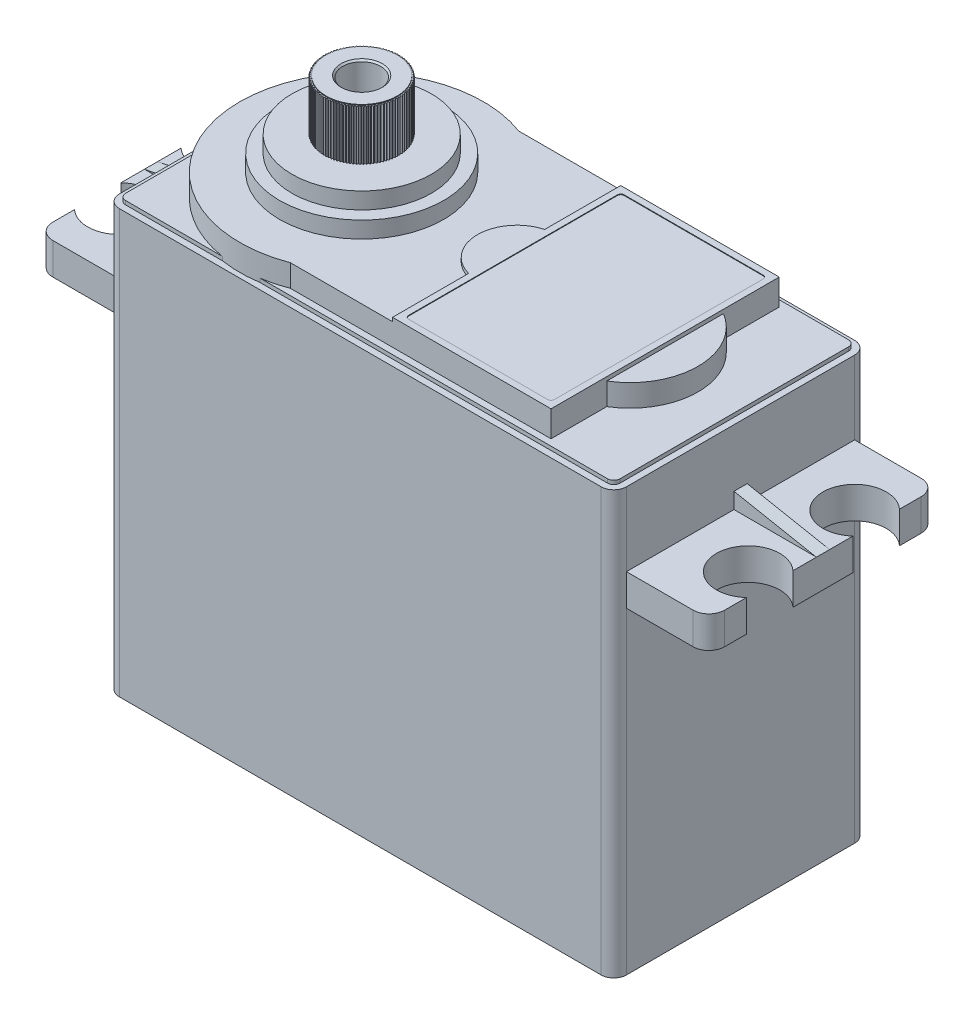
from build123d import *

# Parameters (mm, degrees)
SKETCH2_W                 = 40
SKETCH2_H                 = 20
BOSS_EXTRUDE1_DEPTH       = 33.35
SKETCH3_W                 = 39
SKETCH3_H                 = 19
BOSS_EXTRUDE2_DEPTH       = 0.3
FILLET5_R                 = 1
FILLET6_R                 = 0.5
SKETCH4_W                 = 18
SKETCH4_H                 = 2.5
BOSS_EXTRUDE3_DEPTH       = 6.5
FILLET7_R                 = 1.25
SKETCH5_R                 = 2.5
CUT_EXTRUDE1_DEPTH        = 3
BOSS_EXTRUDE4_DEPTH       = 0.52
FILLET7_OF_MIRROR3_R      = 1.25
BOSS_EXTRUDE5_DEPTH       = 1.2
CHAMFER1_SIZE             = 1.2
CUT_EXTRUDE2_START        = -1.2
CUT_EXTRUDE2_DEPTH        = 1.2
SKETCH11_R                = 1
CUT_EXTRUDE3_DEPTH        = 3.5
SKETCH12_R                = 2
CUT_EXTRUDE4_DEPTH        = 1.3
CHAMFER2_SIZE             = 0.25
SKETCH13_R                = 2.5
CUT_EXTRUDE5_DEPTH        = 8.75
SKETCH14_W                = 6.85
SKETCH14_H                = 3.5
BOSS_EXTRUDE6_DEPTH       = 5.4
SKETCH15_R                = 0.6
BOSS_EXTRUDE8_DEPTH       = 1
SKETCH16_R                = 0.6
BOSS_EXTRUDE9_DEPTH       = 1
SKETCH17_R                = 0.6
BOSS_EXTRUDE10_DEPTH      = 1
BOSS_EXTRUDE11_DEPTH      = 1.75
BOSS_EXTRUDE11_DEPTH_BACK = 0.5
SKETCH19_W                = 20.55
SKETCH19_H                = 18
BOSS_EXTRUDE12_DEPTH      = 1.75
BOSS_EXTRUDE13_DEPTH      = 1.75
BOSS_EXTRUDE14_DEPTH      = 0.3
SKETCH22_R                = 6.475
BOSS_EXTRUDE15_DEPTH      = 1.3
SKETCH23_R                = 5.5
BOSS_EXTRUDE16_DEPTH      = 1.3
SKETCH25_R                = 2.95
BOSS_EXTRUDE17_DEPTH      = 4
SKETCH26_R                = 1.5
CUT_EXTRUDE7_DEPTH        = 5
CUT_EXTRUDE10_START       = -4
CUT_EXTRUDE10_DEPTH       = 4
CIRPATTERN1_START         = 38
CIRPATTERN1_DEPTH         = 4
CUT_EXTRUDE11_DEPTH       = 4
CIRPATTERN2_START         = 38
CIRPATTERN2_DEPTH         = 4
CHAMFER3_SIZE             = 0.125
SKETCH30_OUTSIDE_W        = 69.248
SKETCH30_OUTSIDE_H        = 36.248
SKETCH30_OUTSIDE_R        = 2.8
CUT_EXTRUDE12_DEPTH       = 0.0625
CUT_EXTRUDE13_START       = -5
SKETCH31_W                = 6.25
SKETCH31_H                = 2.9
SKETCH31_R                = 0.6
CUT_EXTRUDE13_DEPTH       = 5
CUT_EXTRUDE14_DEPTH       = 0.05


# Read off the part's stored shape, not the designer's step: CirPattern1, CirPattern2
with BuildPart() as part:
    # Sketch2 → Boss-Extrude1 (new body)
    with BuildSketch(Plane(origin=(0, 0, 0), x_dir=(1, 0, 0), z_dir=(0, 1, 0))):
        Rectangle(SKETCH2_W, SKETCH2_H)
    extrude(amount=BOSS_EXTRUDE1_DEPTH)

    # Sketch3 → Boss-Extrude2 (add)
    with BuildSketch(Plane(origin=(0, 33.35, 0), x_dir=(1, 0, 0), z_dir=(0, 1, 0))):
        Rectangle(SKETCH3_W, SKETCH3_H)
    extrude(amount=BOSS_EXTRUDE2_DEPTH)

    # Fillet5
    fillet5_edges = [part.edges().sort_by_distance(p)[0] for p in [
        (-20, 16.675, -10),
        (20, 16.675, -10),
        (20, 16.675, 10),
        (-20, 16.675, 10),
    ]]
    fillet(fillet5_edges, radius=FILLET5_R)

    # Fillet6
    fillet6_edges = [part.edges().sort_by_distance(p)[0] for p in [
        (-19.5, 33.5, -9.5),
        (-19.5, 33.5, 9.5),
        (19.5, 33.5, 9.5),
        (19.5, 33.5, -9.5),
    ]]
    fillet(fillet6_edges, radius=FILLET6_R)

    # Sketch4 → Boss-Extrude3 (add)
    with BuildSketch(Plane.ZY.offset(20)):
        with Locations((0, 26.3)):
            Rectangle(SKETCH4_W, SKETCH4_H)
    boss_extrude3 = extrude(amount=BOSS_EXTRUDE3_DEPTH)

    # Fillet7
    fillet7_edges = [part.edges().sort_by_distance(p)[0] for p in [
        (-26.5, 26.3, 9),
        (-26.5, 26.3, -9),
    ]]
    fillet(fillet7_edges, radius=FILLET7_R)

    # Sketch5 → Cut-Extrude1 (cut)
    with BuildSketch(Plane(origin=(0, 27.55, 0), x_dir=(1, 0, 0), z_dir=(0, 1, 0))):
        with Locations((-24.8, 4.2)):
            Circle(SKETCH5_R)
        with Locations((-24.8, -4.2)):
            Circle(SKETCH5_R)
    cut_extrude1 = extrude(amount=-CUT_EXTRUDE1_DEPTH, mode=Mode.SUBTRACT)

    # Sketch7 → Boss-Extrude4 (add, symmetric)
    with BuildSketch(Plane(origin=(0, 0, 0), x_dir=(-1, 0, 0), z_dir=(0, 0, -1))):
        Polygon((26.5, 27.55), (20, 28.8), (20, 27.55), align=None)
    boss_extrude4 = extrude(amount=BOSS_EXTRUDE4_DEPTH, both=True)

    # Mirror3: Boss-Extrude3, Cut-Extrude1, Boss-Extrude4 across plane
    add(boss_extrude3.mirror(Plane.ZY))
    add(cut_extrude1.mirror(Plane.ZY), mode=Mode.SUBTRACT)
    add(boss_extrude4.mirror(Plane.ZY))

    # Fillet7 of Mirror3
    fillet7_of_mirror3_edges = [part.edges().sort_by_distance(p)[0] for p in [
        (26.5, 26.3, 9),
        (26.5, 26.3, -9),
    ]]
    fillet(fillet7_of_mirror3_edges, radius=FILLET7_OF_MIRROR3_R)

    # Sketch9 → Boss-Extrude5 (add)
    with BuildSketch(Plane.XZ):
        with BuildLine():
            Line((-19, 10), (19, 10))
            ThreePointArc((19, 10), (19.707106781, 9.707106781), (20, 9))
            Line((20, 9), (20, -9))
            ThreePointArc((20, -9), (19.707106781, -9.707106781), (19, -10))
            Line((19, -10), (-19, -10))
            ThreePointArc((-19, -10), (-19.707106781, -9.707106781), (-20, -9))
            Line((-20, -9), (-20, 9))
            ThreePointArc((-20, 9), (-19.707106781, 9.707106781), (-19, 10))
        make_face()
    extrude(amount=BOSS_EXTRUDE5_DEPTH)

    # Chamfer1
    # the kernel refuses this chamfer: 1.2 mm, written as the material it takes off along each edge
    with BuildSketch(Plane(origin=(-20, -1.2, -12.086019586), x_dir=(-0.027495876610587354, 0.9996219169112968, 0), z_dir=(0, 0, 1))) as chamfer1_piece_1:
        Polygon((CHAMFER1_SIZE * 0.999621916911, -CHAMFER1_SIZE * 0.0274958766106), (-CHAMFER1_SIZE * 0.0274958766106, -CHAMFER1_SIZE * 0.999621916911), (0, 0), align=None)
    extrude(amount=24.172039171, mode=Mode.SUBTRACT)
    with BuildSketch(Plane(origin=(22.086019586, -1.2, -10), x_dir=(0, 0.9996219169112968, -0.027495876610585914), z_dir=(-1, 0, 0)), Plane(origin=(-22.086019586, -1.2, 10), x_dir=(0, 0.9996219169112968, 0.027495876610585914), z_dir=(1, 0, 0))) as chamfer1_piece_2:
        Polygon((CHAMFER1_SIZE * 0.999621916911, -CHAMFER1_SIZE * 0.0274958766106), (-CHAMFER1_SIZE * 0.0274958766106, -CHAMFER1_SIZE * 0.999621916911), (0, 0), align=None)
    extrude(amount=44.172039171, mode=Mode.SUBTRACT)
    with BuildSketch(Plane(origin=(20, -1.2, 12.086019586), x_dir=(-0.9996219169112968, -0.027495876610586445, 0), z_dir=(0, 0, -1))) as chamfer1_piece_3:
        Polygon((CHAMFER1_SIZE * 0.999621916911, CHAMFER1_SIZE * 0.0274958766106), (-CHAMFER1_SIZE * 0.0274958766106, CHAMFER1_SIZE * 0.999621916911), (0, 0), align=None)
    extrude(amount=24.172039171, mode=Mode.SUBTRACT)

    # Sketch10 → Cut-Extrude2 (cut)
    with BuildSketch(Plane.XZ.offset(1.2).offset(CUT_EXTRUDE2_START)):
        with BuildLine():
            Line((-15.2, 10), (-15.2, 7.6))
            ThreePointArc((-15.2, 7.6), (-15.902943725, 5.902943725), (-17.6, 5.2))
            Line((-17.6, 5.2), (-20, 5.2))
            Line((-20, 5.2), (-20, 9))
            ThreePointArc((-20, 9), (-19.707106781, 9.707106781), (-19, 10))
            Line((-19, 10), (-15.2, 10))
        make_face()
        with BuildLine():
            Line((20, 9), (20, 5.2))
            Line((20, 5.2), (17.6, 5.2))
            ThreePointArc((17.6, 5.2), (15.902943725, 5.902943725), (15.2, 7.6))
            Line((15.2, 7.6), (15.2, 10))
            Line((15.2, 10), (19, 10))
            ThreePointArc((19, 10), (19.707106781, 9.707106781), (20, 9))
        make_face()
        with BuildLine():
            Line((15.2, -10), (15.2, -7.6))
            ThreePointArc((15.2, -7.6), (15.902943725, -5.902943725), (17.6, -5.2))
            Line((17.6, -5.2), (20, -5.2))
            Line((20, -5.2), (20, -9))
            ThreePointArc((20, -9), (19.707106781, -9.707106781), (19, -10))
            Line((19, -10), (15.2, -10))
        make_face()
        with BuildLine():
            Line((-20, -9), (-20, -5.2))
            Line((-20, -5.2), (-17.6, -5.2))
            ThreePointArc((-17.6, -5.2), (-15.902943725, -5.902943725), (-15.2, -7.6))
            Line((-15.2, -7.6), (-15.2, -10))
            Line((-15.2, -10), (-19, -10))
            ThreePointArc((-19, -10), (-19.707106781, -9.707106781), (-20, -9))
        make_face()
    extrude(amount=CUT_EXTRUDE2_DEPTH, mode=Mode.SUBTRACT)

    # Sketch11 → Cut-Extrude3 (cut)
    with BuildSketch(Plane.XZ):
        with Locations(Location((-17.6, 7.6, 0), (0, 0, 270))):
            Circle(SKETCH11_R)
        with Locations(Location((17.6, 7.6, 0), (0, 0, 90))):
            Circle(SKETCH11_R)
        with Locations(Location((17.6, -7.6, 0), (0, 0, 270))):
            Circle(SKETCH11_R)
        with Locations(Location((-17.6, -7.6, 0), (0, 0, 90))):
            Circle(SKETCH11_R)
    extrude(amount=-CUT_EXTRUDE3_DEPTH, mode=Mode.SUBTRACT)

    # Sketch12 → Cut-Extrude4 (cut)
    with BuildSketch(Plane.XZ):
        with Locations(Location((-17.6, 7.6, 0), (0, 0, 270))):
            Circle(SKETCH12_R)
        with Locations(Location((17.6, 7.6, 0), (0, 0, 90))):
            Circle(SKETCH12_R)
        with Locations(Location((17.6, -7.6, 0), (0, 0, 270))):
            Circle(SKETCH12_R)
        with Locations(Location((-17.6, -7.6, 0), (0, 0, 90))):
            Circle(SKETCH12_R)
    extrude(amount=-CUT_EXTRUDE4_DEPTH, mode=Mode.SUBTRACT)

    # Chamfer2
    chamfer2_edges = [part.edges().sort_by_distance(p)[0] for p in [
        (-17.6, 0, -9.6),
        (17.6, 0, -5.6),
        (17.6, 0, 5.6),
        (-17.6, 0, 9.6),
    ]]
    chamfer(chamfer2_edges, length=CHAMFER2_SIZE)

    # Sketch13 → Cut-Extrude5 (cut)
    with BuildSketch(Plane.ZY.offset(20)):
        with Locations((0, 16.85)):
            Circle(SKETCH13_R)
    extrude(amount=-CUT_EXTRUDE5_DEPTH, mode=Mode.SUBTRACT)

    # Sketch14 → Boss-Extrude6 (add)
    with BuildSketch(Plane.ZY.offset(20)):
        with Locations((0, 6.25)):
            Rectangle(SKETCH14_W, SKETCH14_H)
    extrude(amount=BOSS_EXTRUDE6_DEPTH)

    # Sketch15 → Boss-Extrude8 (add)
    with BuildSketch(Plane.ZY.offset(25.4)):
        with Locations((-1.225, 6.25)):
            Circle(SKETCH15_R)
    extrude(amount=BOSS_EXTRUDE8_DEPTH)

    # Sketch16 → Boss-Extrude9 (add)
    with BuildSketch(Plane.ZY.offset(25.4)):
        with Locations((0, 6.25)):
            Circle(SKETCH16_R)
    extrude(amount=BOSS_EXTRUDE9_DEPTH)

    # Sketch17 → Boss-Extrude10 (add)
    with BuildSketch(Plane.ZY.offset(25.4)):
        with Locations((1.23, 6.25)):
            Circle(SKETCH17_R)
    extrude(amount=BOSS_EXTRUDE10_DEPTH)

    # Sketch18 → Boss-Extrude11 (add, two sides: drawn at the far end of the back side and taken through both)
    with BuildSketch(Plane(origin=(0, 33.65, 0), x_dir=(1, 0, 0), z_dir=(0, 1, 0)).offset(-BOSS_EXTRUDE11_DEPTH_BACK)):
        with BuildLine():
            Line((-6.5, 9), (-6.5, -9))
            ThreePointArc((-6.5, -9), (-19.5, 0), (-6.5, 9))
        make_face()
    extrude(amount=BOSS_EXTRUDE11_DEPTH + BOSS_EXTRUDE11_DEPTH_BACK)

    # Sketch19 → Boss-Extrude12 (add)
    with BuildSketch(Plane(origin=(0, 33.65, 0), x_dir=(1, 0, 0), z_dir=(0, 1, 0))):
        with Locations((3.775, 0)):
            Rectangle(SKETCH19_W, SKETCH19_H)
    extrude(amount=BOSS_EXTRUDE12_DEPTH)

    # Sketch20 → Boss-Extrude13 (add)
    with BuildSketch(Plane(origin=(0, 33.65, 0), x_dir=(1, 0, 0), z_dir=(0, 1, 0))):
        with BuildLine():
            Line((14.05, 4.6), (14.05, -4.6))
            ThreePointArc((14.05, -4.6), (16.65, 0), (14.05, 4.6))
        make_face()
    extrude(amount=BOSS_EXTRUDE13_DEPTH)

    # Sketch21 → Boss-Extrude14 (add)
    with BuildSketch(Plane(origin=(0, 35.4, 0), x_dir=(1, 0, 0), z_dir=(0, 1, 0))):
        with BuildLine():
            Line((14.05, 9), (1.55, 9))
            Line((1.55, 9), (1.55, 3))
            ThreePointArc((1.55, 3), (-0.75, 0), (1.55, -3))
            Line((1.55, -3), (1.55, -9))
            Line((1.55, -9), (14.05, -9))
            Line((14.05, -9), (14.05, 9))
        make_face()
    extrude(amount=BOSS_EXTRUDE14_DEPTH)

    # Sketch22 → Boss-Extrude15 (add)
    with BuildSketch(Plane(origin=(0, 35.4, 0), x_dir=(1, 0, 0), z_dir=(0, 1, 0))):
        with Locations(Location((-9.884615385, 0, 0), (0, 0, 270))):
            Circle(SKETCH22_R)
    extrude(amount=BOSS_EXTRUDE15_DEPTH)

    # Sketch23 → Boss-Extrude16 (add)
    with BuildSketch(Plane(origin=(0, 36.7, 0), x_dir=(1, 0, 0), z_dir=(0, 1, 0))):
        with Locations(Location((-9.884615385, 0, 0), (0, 0, 270))):
            Circle(SKETCH23_R)
    extrude(amount=BOSS_EXTRUDE16_DEPTH)

    # Sketch25 → Boss-Extrude17 (add)
    with BuildSketch(Plane(origin=(0, 38, 0), x_dir=(1, 0, 0), z_dir=(0, 1, 0))):
        with Locations(Location((-9.884615385, 0, 0), (0, 0, 270))):
            Circle(SKETCH25_R)
    extrude(amount=BOSS_EXTRUDE17_DEPTH)

    # Sketch26 → Cut-Extrude7 (cut)
    with BuildSketch(Plane(origin=(0, 42, 0), x_dir=(1, 0, 0), z_dir=(0, 1, 0))):
        with Locations(Location((-9.884615385, 0, 0), (0, 0, 270))):
            Circle(SKETCH26_R)
    extrude(amount=-CUT_EXTRUDE7_DEPTH, mode=Mode.SUBTRACT)

    # Sketch28 → Cut-Extrude10 (cut)
    with BuildSketch(Plane(origin=(0, 42, 0), x_dir=(1, 0, 0), z_dir=(0, 1, 0)).offset(CUT_EXTRUDE10_START)):
        with BuildLine():
            Line((-9.884615385, 2.850000942), (-9.786256523, 2.948359804))
            ThreePointArc((-9.786256523, 2.948359804), (-9.884615385, 2.95), (-9.982974246, 2.948359804))
            Line((-9.982974246, 2.948359804), (-9.884615385, 2.850000942))
        make_face()
    extrude(amount=CUT_EXTRUDE10_DEPTH, mode=Mode.SUBTRACT)

    # CirPattern1 outline → CirPattern1 (cut)
    with BuildSketch(Plane(origin=(0, 0, 0), x_dir=(1, 0, 0), z_dir=(0, 1, 0)).offset(CIRPATTERN1_START)):
        with BuildLine():
            Line((-6.938157395, 0.096457047), (-7.034614442, 0))
            Line((-7.034614442, 0), (-6.938157395, -0.096457047))
            Line((-6.938157395, -0.096457047), (-7.040716513, -0.18639898))
            Line((-7.040716513, -0.18639898), (-6.95077458, -0.288958098))
            Line((-6.95077458, -0.288958098), (-7.058996595, -0.371999771))
            Line((-7.058996595, -0.371999771), (-6.975954923, -0.480221786))
            Line((-6.975954923, -0.480221786), (-7.089376411, -0.556007602))
            Line((-7.089376411, -0.556007602), (-7.013590595, -0.66942909))
            Line((-7.013590595, -0.66942909), (-7.131725869, -0.737634522))
            Line((-7.131725869, -0.737634522), (-7.063520437, -0.855769796))
            Line((-7.063520437, -0.855769796), (-7.185863623, -0.916102779))
            Line((-7.185863623, -0.916102779), (-7.125530641, -1.038445965))
            Line((-7.125530641, -1.038445965), (-7.251557846, -1.090648143))
            Line((-7.251557846, -1.090648143), (-7.199355668, -1.216675349))
            Line((-7.199355668, -1.216675349), (-7.328527226, -1.260523184))
            Line((-7.328527226, -1.260523184), (-7.284679391, -1.389694742))
            Line((-7.284679391, -1.389694742), (-7.416442168, -1.425000471))
            Line((-7.416442168, -1.425000471), (-7.381136438, -1.556763248))
            Line((-7.381136438, -1.556763248), (-7.514926206, -1.583375688))
            Line((-7.514926206, -1.583375688), (-7.488313766, -1.717165456))
            Line((-7.488313766, -1.717165456), (-7.623557617, -1.734970646))
            Line((-7.623557617, -1.734970646), (-7.605752426, -1.870214497))
            Line((-7.605752426, -1.870214497), (-7.741871225, -1.879136194))
            Line((-7.741871225, -1.879136194), (-7.732949527, -2.015254993))
            Line((-7.732949527, -2.015254993), (-7.869360392, -2.015254993))
            Line((-7.869360392, -2.015254993), (-7.869360392, -2.151665857))
            Line((-7.869360392, -2.151665857), (-8.00547919, -2.14274416))
            Line((-8.00547919, -2.14274416), (-8.014400888, -2.278862958))
            Line((-8.014400888, -2.278862958), (-8.149644738, -2.261057767))
            Line((-8.149644738, -2.261057767), (-8.167449929, -2.396301618))
            Line((-8.167449929, -2.396301618), (-8.301239697, -2.369689179))
            Line((-8.301239697, -2.369689179), (-8.327852136, -2.503478947))
            Line((-8.327852136, -2.503478947), (-8.459614913, -2.468173217))
            Line((-8.459614913, -2.468173217), (-8.494920643, -2.599935994))
            Line((-8.494920643, -2.599935994), (-8.624092201, -2.556088159))
            Line((-8.624092201, -2.556088159), (-8.667940036, -2.685259716))
            Line((-8.667940036, -2.685259716), (-8.793967242, -2.633057538))
            Line((-8.793967242, -2.633057538), (-8.84616942, -2.759084744))
            Line((-8.84616942, -2.759084744), (-8.968512606, -2.698751761))
            Line((-8.968512606, -2.698751761), (-9.028845588, -2.821094947))
            Line((-9.028845588, -2.821094947), (-9.146980862, -2.752889515))
            Line((-9.146980862, -2.752889515), (-9.215186294, -2.871024789))
            Line((-9.215186294, -2.871024789), (-9.328607783, -2.795238973))
            Line((-9.328607783, -2.795238973), (-9.404393599, -2.908660462))
            Line((-9.404393599, -2.908660462), (-9.512615614, -2.825618789))
            Line((-9.512615614, -2.825618789), (-9.595657287, -2.933840804))
            Line((-9.595657287, -2.933840804), (-9.698216405, -2.843898872))
            Line((-9.698216405, -2.843898872), (-9.788158337, -2.94645799))
            Line((-9.788158337, -2.94645799), (-9.884615385, -2.850000942))
            Line((-9.884615385, -2.850000942), (-9.981072432, -2.94645799))
            Line((-9.981072432, -2.94645799), (-10.071014365, -2.843898872))
            Line((-10.071014365, -2.843898872), (-10.173573483, -2.933840804))
            Line((-10.173573483, -2.933840804), (-10.256615155, -2.825618789))
            Line((-10.256615155, -2.825618789), (-10.36483717, -2.908660462))
            Line((-10.36483717, -2.908660462), (-10.440622986, -2.795238973))
            Line((-10.440622986, -2.795238973), (-10.554044475, -2.871024789))
            Line((-10.554044475, -2.871024789), (-10.622249907, -2.752889515))
            Line((-10.622249907, -2.752889515), (-10.740385181, -2.821094947))
            Line((-10.740385181, -2.821094947), (-10.800718164, -2.698751761))
            Line((-10.800718164, -2.698751761), (-10.92306135, -2.759084744))
            Line((-10.92306135, -2.759084744), (-10.975263527, -2.633057538))
            Line((-10.975263527, -2.633057538), (-11.101290733, -2.685259716))
            Line((-11.101290733, -2.685259716), (-11.145138569, -2.556088159))
            Line((-11.145138569, -2.556088159), (-11.274310126, -2.599935994))
            Line((-11.274310126, -2.599935994), (-11.309615856, -2.468173217))
            Line((-11.309615856, -2.468173217), (-11.441378633, -2.503478947))
            Line((-11.441378633, -2.503478947), (-11.467991072, -2.369689179))
            Line((-11.467991072, -2.369689179), (-11.60178084, -2.396301618))
            Line((-11.60178084, -2.396301618), (-11.619586031, -2.261057767))
            Line((-11.619586031, -2.261057767), (-11.754829882, -2.278862958))
            Line((-11.754829882, -2.278862958), (-11.763751579, -2.14274416))
            Line((-11.763751579, -2.14274416), (-11.899870377, -2.151665857))
            Line((-11.899870377, -2.151665857), (-11.899870377, -2.015254993))
            Line((-11.899870377, -2.015254993), (-12.036281242, -2.015254993))
            Line((-12.036281242, -2.015254993), (-12.027359544, -1.879136194))
            Line((-12.027359544, -1.879136194), (-12.163478343, -1.870214497))
            Line((-12.163478343, -1.870214497), (-12.145673152, -1.734970646))
            Line((-12.145673152, -1.734970646), (-12.280917003, -1.717165456))
            Line((-12.280917003, -1.717165456), (-12.254304563, -1.583375688))
            Line((-12.254304563, -1.583375688), (-12.388094331, -1.556763248))
            Line((-12.388094331, -1.556763248), (-12.352788602, -1.425000471))
            Line((-12.352788602, -1.425000471), (-12.484551379, -1.389694742))
            Line((-12.484551379, -1.389694742), (-12.440703543, -1.260523184))
            Line((-12.440703543, -1.260523184), (-12.569875101, -1.216675349))
            Line((-12.569875101, -1.216675349), (-12.517672923, -1.090648143))
            Line((-12.517672923, -1.090648143), (-12.643700129, -1.038445965))
            Line((-12.643700129, -1.038445965), (-12.583367146, -0.916102779))
            Line((-12.583367146, -0.916102779), (-12.705710332, -0.855769796))
            Line((-12.705710332, -0.855769796), (-12.6375049, -0.737634522))
            Line((-12.6375049, -0.737634522), (-12.755640174, -0.66942909))
            Line((-12.755640174, -0.66942909), (-12.679854358, -0.556007602))
            Line((-12.679854358, -0.556007602), (-12.793275847, -0.480221786))
            Line((-12.793275847, -0.480221786), (-12.710234174, -0.371999771))
            Line((-12.710234174, -0.371999771), (-12.818456189, -0.288958098))
            Line((-12.818456189, -0.288958098), (-12.728514256, -0.18639898))
            Line((-12.728514256, -0.18639898), (-12.831073374, -0.096457047))
            Line((-12.831073374, -0.096457047), (-12.734616327, 0))
            Line((-12.734616327, 0), (-12.831073374, 0.096457047))
            Line((-12.831073374, 0.096457047), (-12.728514256, 0.18639898))
            Line((-12.728514256, 0.18639898), (-12.818456189, 0.288958098))
            Line((-12.818456189, 0.288958098), (-12.710234174, 0.371999771))
            Line((-12.710234174, 0.371999771), (-12.793275847, 0.480221786))
            Line((-12.793275847, 0.480221786), (-12.679854358, 0.556007602))
            Line((-12.679854358, 0.556007602), (-12.755640174, 0.66942909))
            Line((-12.755640174, 0.66942909), (-12.6375049, 0.737634522))
            Line((-12.6375049, 0.737634522), (-12.705710332, 0.855769796))
            Line((-12.705710332, 0.855769796), (-12.583367146, 0.916102779))
            Line((-12.583367146, 0.916102779), (-12.643700129, 1.038445965))
            Line((-12.643700129, 1.038445965), (-12.517672923, 1.090648143))
            Line((-12.517672923, 1.090648143), (-12.569875101, 1.216675349))
            Line((-12.569875101, 1.216675349), (-12.440703543, 1.260523184))
            Line((-12.440703543, 1.260523184), (-12.484551379, 1.389694742))
            Line((-12.484551379, 1.389694742), (-12.352788602, 1.425000471))
            Line((-12.352788602, 1.425000471), (-12.388094331, 1.556763248))
            Line((-12.388094331, 1.556763248), (-12.254304563, 1.583375688))
            Line((-12.254304563, 1.583375688), (-12.280917003, 1.717165456))
            Line((-12.280917003, 1.717165456), (-12.145673152, 1.734970646))
            Line((-12.145673152, 1.734970646), (-12.163478343, 1.870214497))
            Line((-12.163478343, 1.870214497), (-12.027359544, 1.879136194))
            Line((-12.027359544, 1.879136194), (-12.036281242, 2.015254993))
            Line((-12.036281242, 2.015254993), (-11.899870377, 2.015254993))
            Line((-11.899870377, 2.015254993), (-11.899870377, 2.151665857))
            Line((-11.899870377, 2.151665857), (-11.763751579, 2.14274416))
            Line((-11.763751579, 2.14274416), (-11.754829882, 2.278862958))
            Line((-11.754829882, 2.278862958), (-11.619586031, 2.261057767))
            Line((-11.619586031, 2.261057767), (-11.60178084, 2.396301618))
            Line((-11.60178084, 2.396301618), (-11.467991072, 2.369689179))
            Line((-11.467991072, 2.369689179), (-11.441378633, 2.503478947))
            Line((-11.441378633, 2.503478947), (-11.309615856, 2.468173217))
            Line((-11.309615856, 2.468173217), (-11.274310126, 2.599935994))
            Line((-11.274310126, 2.599935994), (-11.145138569, 2.556088159))
            Line((-11.145138569, 2.556088159), (-11.101290733, 2.685259716))
            Line((-11.101290733, 2.685259716), (-10.975263527, 2.633057538))
            Line((-10.975263527, 2.633057538), (-10.92306135, 2.759084744))
            Line((-10.92306135, 2.759084744), (-10.800718164, 2.698751761))
            Line((-10.800718164, 2.698751761), (-10.740385181, 2.821094947))
            Line((-10.740385181, 2.821094947), (-10.622249907, 2.752889515))
            Line((-10.622249907, 2.752889515), (-10.554044475, 2.871024789))
            Line((-10.554044475, 2.871024789), (-10.440622986, 2.795238973))
            Line((-10.440622986, 2.795238973), (-10.36483717, 2.908660462))
            Line((-10.36483717, 2.908660462), (-10.256615155, 2.825618789))
            Line((-10.256615155, 2.825618789), (-10.173573483, 2.933840804))
            Line((-10.173573483, 2.933840804), (-10.071014365, 2.843898872))
            Line((-10.071014365, 2.843898872), (-9.981072432, 2.94645799))
            Line((-9.981072432, 2.94645799), (-9.982974246, 2.948359804))
            ThreePointArc((-9.982974246, 2.948359804), (-9.884615385, -2.95), (-9.786256523, 2.948359804))
            Line((-9.786256523, 2.948359804), (-9.788158337, 2.94645799))
            Line((-9.788158337, 2.94645799), (-9.698216405, 2.843898872))
            Line((-9.698216405, 2.843898872), (-9.595657287, 2.933840804))
            Line((-9.595657287, 2.933840804), (-9.512615614, 2.825618789))
            Line((-9.512615614, 2.825618789), (-9.404393599, 2.908660462))
            Line((-9.404393599, 2.908660462), (-9.328607783, 2.795238973))
            Line((-9.328607783, 2.795238973), (-9.215186294, 2.871024789))
            Line((-9.215186294, 2.871024789), (-9.146980862, 2.752889515))
            Line((-9.146980862, 2.752889515), (-9.028845588, 2.821094947))
            Line((-9.028845588, 2.821094947), (-8.968512606, 2.698751761))
            Line((-8.968512606, 2.698751761), (-8.84616942, 2.759084744))
            Line((-8.84616942, 2.759084744), (-8.793967242, 2.633057538))
            Line((-8.793967242, 2.633057538), (-8.667940036, 2.685259716))
            Line((-8.667940036, 2.685259716), (-8.624092201, 2.556088159))
            Line((-8.624092201, 2.556088159), (-8.494920643, 2.599935994))
            Line((-8.494920643, 2.599935994), (-8.459614913, 2.468173217))
            Line((-8.459614913, 2.468173217), (-8.327852136, 2.503478947))
            Line((-8.327852136, 2.503478947), (-8.301239697, 2.369689179))
            Line((-8.301239697, 2.369689179), (-8.167449929, 2.396301618))
            Line((-8.167449929, 2.396301618), (-8.149644738, 2.261057767))
            Line((-8.149644738, 2.261057767), (-8.014400888, 2.278862958))
            Line((-8.014400888, 2.278862958), (-8.00547919, 2.14274416))
            Line((-8.00547919, 2.14274416), (-7.869360392, 2.151665857))
            Line((-7.869360392, 2.151665857), (-7.869360392, 2.015254993))
            Line((-7.869360392, 2.015254993), (-7.732949527, 2.015254993))
            Line((-7.732949527, 2.015254993), (-7.741871225, 1.879136194))
            Line((-7.741871225, 1.879136194), (-7.605752426, 1.870214497))
            Line((-7.605752426, 1.870214497), (-7.623557617, 1.734970646))
            Line((-7.623557617, 1.734970646), (-7.488313766, 1.717165456))
            Line((-7.488313766, 1.717165456), (-7.514926206, 1.583375688))
            Line((-7.514926206, 1.583375688), (-7.381136438, 1.556763248))
            Line((-7.381136438, 1.556763248), (-7.416442168, 1.425000471))
            Line((-7.416442168, 1.425000471), (-7.284679391, 1.389694742))
            Line((-7.284679391, 1.389694742), (-7.328527226, 1.260523184))
            Line((-7.328527226, 1.260523184), (-7.199355668, 1.216675349))
            Line((-7.199355668, 1.216675349), (-7.251557846, 1.090648143))
            Line((-7.251557846, 1.090648143), (-7.125530641, 1.038445965))
            Line((-7.125530641, 1.038445965), (-7.185863623, 0.916102779))
            Line((-7.185863623, 0.916102779), (-7.063520437, 0.855769796))
            Line((-7.063520437, 0.855769796), (-7.131725869, 0.737634522))
            Line((-7.131725869, 0.737634522), (-7.013590595, 0.66942909))
            Line((-7.013590595, 0.66942909), (-7.089376411, 0.556007602))
            Line((-7.089376411, 0.556007602), (-6.975954923, 0.480221786))
            Line((-6.975954923, 0.480221786), (-7.058996595, 0.371999771))
            Line((-7.058996595, 0.371999771), (-6.95077458, 0.288958098))
            Line((-6.95077458, 0.288958098), (-7.040716513, 0.18639898))
            Line((-7.040716513, 0.18639898), (-6.938157395, 0.096457047))
        make_face()
    extrude(amount=CIRPATTERN1_DEPTH, mode=Mode.SUBTRACT)

    # Sketch29 → Cut-Extrude11 (cut)
    with BuildSketch(Plane(origin=(0, 42, 0), x_dir=(1, 0, 0), z_dir=(0, 1, 0))):
        Polygon((-9.798158337, 2.93645799), (-9.779388573, 2.93645799), (-9.788158337, 2.94645799), align=None)
    extrude(amount=-CUT_EXTRUDE11_DEPTH, mode=Mode.SUBTRACT)

    # CirPattern2 outline → CirPattern2 (cut)
    with BuildSketch(Plane(origin=(0, 0, 0), x_dir=(1, 0, 0), z_dir=(0, 1, 0)).offset(CIRPATTERN2_START)):
        Polygon((-9.595657287, 2.933840804), (-9.606289907, 2.924516246), (-9.58756033, 2.923288645), align=None)
        Polygon((-9.981072432, 2.94645799), (-9.99039699, 2.935825369), (-9.971667413, 2.937052971), align=None)
        Polygon((-10.173573483, 2.933840804), (-10.182182669, 2.922621094), (-10.163573483, 2.92507104), align=None)
        Polygon((-10.36483717, 2.908660462), (-10.37269412, 2.896901706), (-10.354285011, 2.900563505), align=None)
        Polygon((-10.554044475, 2.871024789), (-10.561115543, 2.85877734), (-10.542985342, 2.863635313), align=None)
        Polygon((-10.740385181, 2.821094947), (-10.746640087, 2.808411252), (-10.728866432, 2.814444595), align=None)
        Polygon((-10.92306135, 2.759084744), (-10.928473311, 2.746019114), (-10.911132309, 2.753201992), align=None)
        Polygon((-11.101290733, 2.685259716), (-11.105836574, 2.671868102), (-11.089002483, 2.680169756), align=None)
        Polygon((-11.274310126, 2.599935994), (-11.27797038, 2.58627574), (-11.261715287, 2.595660622), align=None)
        Polygon((-11.441378633, 2.503478947), (-11.444137627, 2.489608548), (-11.428531138, 2.500036471), align=None)
        Polygon((-11.60178084, 2.396301618), (-11.603626759, 2.38228047), (-11.588735704, 2.393706779), align=None)
        Polygon((-11.754829882, 2.278862958), (-11.755754822, 2.264751102), (-11.741642965, 2.277126868), align=None)
        Polygon((-11.899870377, 2.151665857), (-11.899870377, 2.137523722), (-11.88659815, 2.150795949), align=None)
        Polygon((-12.036281242, 2.015254993), (-12.035356302, 2.001143137), (-12.022980536, 2.015254993), align=None)
        Polygon((-12.163478343, 1.870214497), (-12.161632424, 1.856193349), (-12.150206115, 1.871084405), align=None)
        Polygon((-12.280917003, 1.717165456), (-12.278158009, 1.703295057), (-12.267730086, 1.718901546), align=None)
        Polygon((-12.388094331, 1.556763248), (-12.384434077, 1.543102994), (-12.375049195, 1.559358087), align=None)
        Polygon((-12.484551379, 1.389694742), (-12.480005538, 1.376303127), (-12.471703883, 1.393137217), align=None)
        Polygon((-12.569875101, 1.216675349), (-12.56446314, 1.203609719), (-12.557280262, 1.22095072), align=None)
        Polygon((-12.643700129, 1.038445965), (-12.637445222, 1.025762269), (-12.631411879, 1.043535925), align=None)
        Polygon((-12.705710332, 0.855769796), (-12.698639264, 0.843522348), (-12.693781292, 0.861652548), align=None)
        Polygon((-12.755640174, 0.66942909), (-12.747783224, 0.657670334), (-12.744121425, 0.676079443), align=None)
        Polygon((-12.793275847, 0.480221786), (-12.78466666, 0.469002075), (-12.782216714, 0.487611262), align=None)
        Polygon((-12.818456189, 0.288958098), (-12.809131631, 0.278325478), (-12.80790403, 0.297055055), align=None)
        Polygon((-12.831073374, 0.096457047), (-12.821073374, 0.086457047), (-12.821073374, 0.105226812), align=None)
        Polygon((-12.831073374, -0.096457047), (-12.820440754, -0.105781605), (-12.821668355, -0.087052028), align=None)
        Polygon((-12.818456189, -0.288958098), (-12.807236478, -0.297567285), (-12.809686424, -0.278958098), align=None)
        Polygon((-12.793275847, -0.480221786), (-12.781517091, -0.488078735), (-12.78517889, -0.469669627), align=None)
        Polygon((-12.755640174, -0.66942909), (-12.743392725, -0.676500158), (-12.748250698, -0.658369958), align=None)
        Polygon((-12.705710332, -0.855769796), (-12.693026636, -0.862024703), (-12.699059979, -0.844251047), align=None)
        Polygon((-12.643700129, -1.038445965), (-12.630634499, -1.043857926), (-12.637817377, -1.026516925), align=None)
        Polygon((-12.569875101, -1.216675349), (-12.556483486, -1.22122119), (-12.564785141, -1.204387099), align=None)
        Polygon((-12.484551379, -1.389694742), (-12.470891125, -1.393354996), (-12.480276007, -1.377099903), align=None)
        Polygon((-12.388094331, -1.556763248), (-12.374223933, -1.559522242), (-12.384651855, -1.543915753), align=None)
        Polygon((-12.280917003, -1.717165456), (-12.266895855, -1.719011375), (-12.278322164, -1.704120319), align=None)
        Polygon((-12.163478343, -1.870214497), (-12.149366487, -1.871139437), (-12.161742252, -1.857027581), align=None)
        Polygon((-12.036281242, -2.015254993), (-12.022139106, -2.015254993), (-12.035411334, -2.001982765), align=None)
        Polygon((-11.899870377, -2.151665857), (-11.885758521, -2.150740917), (-11.899870377, -2.138365152), align=None)
        Polygon((-11.754829882, -2.278862958), (-11.740808734, -2.277017039), (-11.755699789, -2.26559073), align=None)
        Polygon((-11.60178084, -2.396301618), (-11.587910442, -2.393542624), (-11.603516931, -2.383114702), align=None)
        Polygon((-11.441378633, -2.503478947), (-11.427718379, -2.499818693), (-11.443973472, -2.49043381), align=None)
        Polygon((-11.274310126, -2.599935994), (-11.260918512, -2.595390154), (-11.277752602, -2.587088499), align=None)
        Polygon((-11.101290733, -2.685259716), (-11.088225104, -2.679847755), (-11.105566105, -2.672664877), align=None)
        Polygon((-10.92306135, -2.759084744), (-10.910377654, -2.752829837), (-10.928151309, -2.746796494), align=None)
        Polygon((-10.740385181, -2.821094947), (-10.728137732, -2.814023879), (-10.746267933, -2.809165907), align=None)
        Polygon((-10.554044475, -2.871024789), (-10.542285719, -2.86316784), (-10.560694828, -2.85950604), align=None)
        Polygon((-10.36483717, -2.908660462), (-10.35361746, -2.900051275), (-10.372226647, -2.897601329), align=None)
        Polygon((-10.173573483, -2.933840804), (-10.162940862, -2.924516246), (-10.181670439, -2.923288645), align=None)
        Polygon((-9.981072432, -2.94645799), (-9.971072432, -2.93645799), (-9.989842197, -2.93645799), align=None)
        Polygon((-9.788158337, -2.94645799), (-9.778833779, -2.935825369), (-9.797563356, -2.937052971), align=None)
        Polygon((-9.595657287, -2.933840804), (-9.5870481, -2.922621094), (-9.605657287, -2.92507104), align=None)
        Polygon((-9.404393599, -2.908660462), (-9.396536649, -2.896901706), (-9.414945758, -2.900563505), align=None)
        Polygon((-9.215186294, -2.871024789), (-9.208115226, -2.85877734), (-9.226245427, -2.863635313), align=None)
        Polygon((-9.028845588, -2.821094947), (-9.022590682, -2.808411252), (-9.040364337, -2.814444595), align=None)
        Polygon((-8.84616942, -2.759084744), (-8.840757459, -2.746019114), (-8.85809846, -2.753201992), align=None)
        Polygon((-8.667940036, -2.685259716), (-8.663394196, -2.671868102), (-8.680228286, -2.680169756), align=None)
        Polygon((-8.494920643, -2.599935994), (-8.491260389, -2.58627574), (-8.507515482, -2.595660622), align=None)
        Polygon((-8.327852136, -2.503478947), (-8.325093142, -2.489608548), (-8.340699632, -2.500036471), align=None)
        Polygon((-8.167449929, -2.396301618), (-8.16560401, -2.38228047), (-8.180495065, -2.393706779), align=None)
        Polygon((-8.014400888, -2.278862958), (-8.013475948, -2.264751102), (-8.027587804, -2.277126868), align=None)
        Polygon((-7.869360392, -2.151665857), (-7.869360392, -2.137523722), (-7.88263262, -2.150795949), align=None)
        Polygon((-7.732949527, -2.015254993), (-7.733874467, -2.001143137), (-7.746250233, -2.015254993), align=None)
        Polygon((-7.605752426, -1.870214497), (-7.607598345, -1.856193349), (-7.619024654, -1.871084405), align=None)
        Polygon((-7.488313766, -1.717165456), (-7.49107276, -1.703295057), (-7.501500683, -1.718901546), align=None)
        Polygon((-7.381136438, -1.556763248), (-7.384796692, -1.543102994), (-7.394181574, -1.559358087), align=None)
        Polygon((-7.284679391, -1.389694742), (-7.289225232, -1.376303127), (-7.297526886, -1.393137217), align=None)
        Polygon((-7.199355668, -1.216675349), (-7.204767629, -1.203609719), (-7.211950507, -1.22095072), align=None)
        Polygon((-7.125530641, -1.038445965), (-7.131785547, -1.025762269), (-7.13781889, -1.043535925), align=None)
        Polygon((-7.063520437, -0.855769796), (-7.070591505, -0.843522348), (-7.075449478, -0.861652548), align=None)
        Polygon((-7.013590595, -0.66942909), (-7.021447545, -0.657670334), (-7.025109344, -0.676079443), align=None)
        Polygon((-6.975954923, -0.480221786), (-6.98456411, -0.469002075), (-6.987014055, -0.487611262), align=None)
        Polygon((-6.95077458, -0.288958098), (-6.960099138, -0.278325478), (-6.96132674, -0.297055055), align=None)
        Polygon((-6.938157395, -0.096457047), (-6.948157395, -0.086457047), (-6.948157395, -0.105226812), align=None)
        Polygon((-6.938157395, 0.096457047), (-6.948790015, 0.105781605), (-6.947562414, 0.087052028), align=None)
        Polygon((-6.95077458, 0.288958098), (-6.961994291, 0.297567285), (-6.959544345, 0.278958098), align=None)
        Polygon((-6.975954923, 0.480221786), (-6.987713679, 0.488078735), (-6.984051879, 0.469669627), align=None)
        Polygon((-7.013590595, 0.66942909), (-7.025838044, 0.676500158), (-7.020980072, 0.658369958), align=None)
        Polygon((-7.063520437, 0.855769796), (-7.076204133, 0.862024703), (-7.07017079, 0.844251047), align=None)
        Polygon((-7.125530641, 1.038445965), (-7.13859627, 1.043857926), (-7.131413392, 1.026516925), align=None)
        Polygon((-7.199355668, 1.216675349), (-7.212747283, 1.22122119), (-7.204445628, 1.204387099), align=None)
        Polygon((-7.284679391, 1.389694742), (-7.298339645, 1.393354996), (-7.288954762, 1.377099903), align=None)
        Polygon((-7.381136438, 1.556763248), (-7.395006836, 1.559522242), (-7.384578914, 1.543915753), align=None)
        Polygon((-7.488313766, 1.717165456), (-7.502334914, 1.719011375), (-7.490908605, 1.704120319), align=None)
        Polygon((-7.605752426, 1.870214497), (-7.619864283, 1.871139437), (-7.607488517, 1.857027581), align=None)
        Polygon((-7.732949527, 2.015254993), (-7.747091663, 2.015254993), (-7.733819435, 2.001982765), align=None)
        Polygon((-7.869360392, 2.151665857), (-7.883472248, 2.150740917), (-7.869360392, 2.138365152), align=None)
        Polygon((-8.014400888, 2.278862958), (-8.028422035, 2.277017039), (-8.01353098, 2.26559073), align=None)
        Polygon((-8.167449929, 2.396301618), (-8.181320327, 2.393542624), (-8.165713838, 2.383114702), align=None)
        Polygon((-8.327852136, 2.503478947), (-8.34151239, 2.499818693), (-8.325257297, 2.49043381), align=None)
        Polygon((-8.494920643, 2.599935994), (-8.508312257, 2.595390154), (-8.491478167, 2.587088499), align=None)
        Polygon((-8.667940036, 2.685259716), (-8.681005666, 2.679847755), (-8.663664664, 2.672664877), align=None)
        Polygon((-8.84616942, 2.759084744), (-8.858853116, 2.752829837), (-8.84107946, 2.746796494), align=None)
        Polygon((-9.028845588, 2.821094947), (-9.041093037, 2.814023879), (-9.022962836, 2.809165907), align=None)
        Polygon((-9.215186294, 2.871024789), (-9.22694505, 2.86316784), (-9.208535942, 2.85950604), align=None)
        Polygon((-9.404393599, 2.908660462), (-9.415613309, 2.900051275), (-9.397004123, 2.897601329), align=None)
    extrude(amount=CIRPATTERN2_DEPTH, mode=Mode.SUBTRACT)

    # Chamfer3
    chamfer3_edges = [part.edges().sort_by_distance(p)[0] for p in [
        (-9.884615385, 42, -1.5),
    ]]
    chamfer(chamfer3_edges, length=CHAMFER3_SIZE)

    # Sketch30 outside → Cut-Extrude12 (cut)
    with BuildSketch(Plane(origin=(0, 42, 0), x_dir=(1, 0, 0), z_dir=(0, 1, 0))):
        Rectangle(SKETCH30_OUTSIDE_W, SKETCH30_OUTSIDE_H)
        with Locations(Location((-9.884615385, 0, 0), (0, 0, 270))):
            Circle(SKETCH30_OUTSIDE_R, mode=Mode.SUBTRACT)
    extrude(amount=-CUT_EXTRUDE12_DEPTH, mode=Mode.SUBTRACT)

    # Sketch31 → Cut-Extrude13 (cut)
    with BuildSketch(Plane.ZY.offset(25.4).offset(CUT_EXTRUDE13_START)):
        with Locations((0, 6.25)):
            Rectangle(SKETCH31_W, SKETCH31_H)
        with Locations((-1.225, 6.25)):
            Circle(SKETCH31_R, mode=Mode.SUBTRACT)
        with Locations((0, 6.25)):
            Circle(SKETCH31_R, mode=Mode.SUBTRACT)
        with Locations((1.23, 6.25)):
            Circle(SKETCH31_R, mode=Mode.SUBTRACT)
    extrude(amount=CUT_EXTRUDE13_DEPTH, mode=Mode.SUBTRACT)

    # Sketch24 → Cut-Extrude14 (cut)
    with BuildSketch(Plane(origin=(0, 35.7, 0), x_dir=(1, 0, 0), z_dir=(0, 1, 0))):
        with BuildLine():
            Line((13.285416667, 8.5), (2.314583333, 8.5))
            ThreePointArc((2.314583333, 8.5), (2.127494664, 8.422505336), (2.05, 8.235416667))
            Line((2.05, 8.235416667), (2.05, -8.235416667))
            ThreePointArc((2.05, -8.235416667), (2.127494664, -8.422505336), (2.314583333, -8.5))
            Line((2.314583333, -8.5), (13.285416667, -8.5))
            ThreePointArc((13.285416667, -8.5), (13.472505336, -8.422505336), (13.55, -8.235416667))
            Line((13.55, -8.235416667), (13.55, 8.235416667))
            ThreePointArc((13.55, 8.235416667), (13.472505336, 8.422505336), (13.285416667, 8.5))
        make_face()
    extrude(amount=-CUT_EXTRUDE14_DEPTH, mode=Mode.SUBTRACT)


solid = part.part
